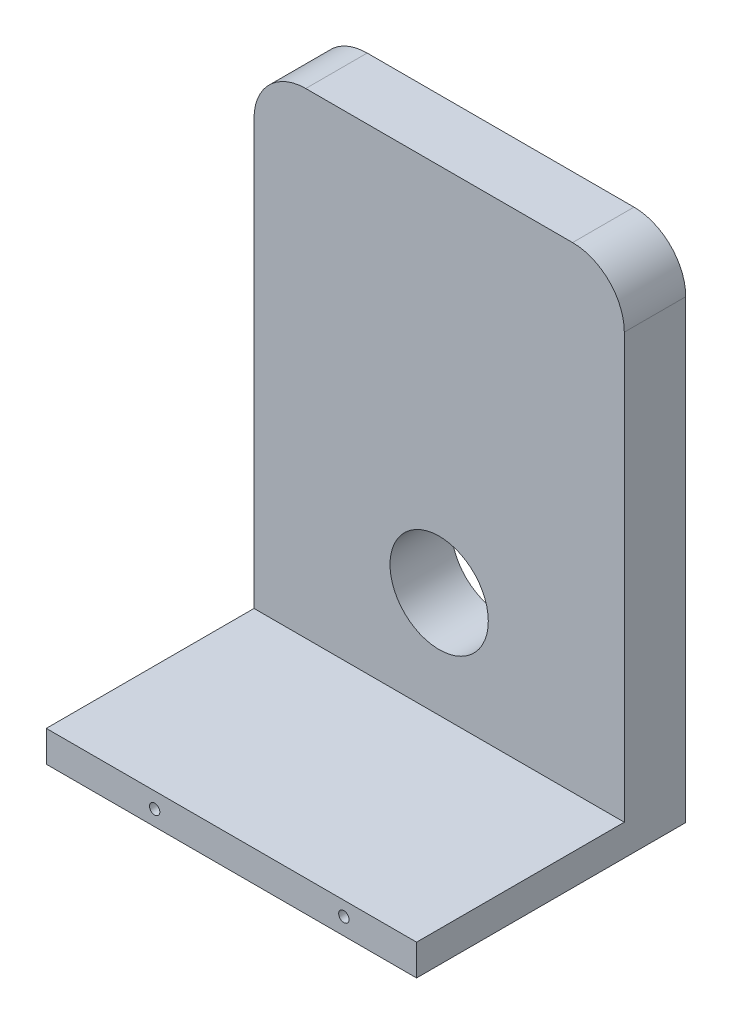
from build123d import *

# Parameters (mm, degrees)
FRONT_WALL_DEPTH               = 7.300124661
FRONT_WALL_DEPTH_BACK          = 4.572
SKETCH1_W                      = 71.574446128
SKETCH1_H                      = 98.031926214
SKETCH2_W                      = 71.574446128
SKETCH2_H                      = 6
BOSS_EXTRUDE1_DEPTH            = 47.452211665
HOLE_FOR_CENTER_ROD_DEPTH      = 34
HOLE_FOR_CENTER_ROD_DEPTH_BACK = 24
SKETCH3_R                      = 9.5
FILLET2_R                      = 10
FILLET3_R                      = 10
BASE_HOLES_DEPTH               = 22
BASE_HOLES_DEPTH_BACK          = 24
SKETCH4_R                      = 1


with BuildPart() as part:
    # Sketch1 → Front wall (new, two sides: drawn at the far end of the back side and taken through both)
    with BuildSketch(Plane.XY.offset(-FRONT_WALL_DEPTH_BACK)):
        Rectangle(SKETCH1_W, SKETCH1_H)
    extrude(amount=FRONT_WALL_DEPTH + FRONT_WALL_DEPTH_BACK)

    # Sketch2 → Boss-Extrude1 (add)
    with BuildSketch(Plane.XY):
        with Locations((0, -46.015963107)):
            Rectangle(SKETCH2_W, SKETCH2_H)
    extrude(amount=BOSS_EXTRUDE1_DEPTH)

    # Sketch3 → Hole for center rod (cut, two sides: drawn at the far end of the back side and taken through both)
    with BuildSketch(Plane.XY.offset(-HOLE_FOR_CENTER_ROD_DEPTH_BACK)):
        with Locations((0, -22.515963107)):
            Circle(SKETCH3_R)
    extrude(amount=HOLE_FOR_CENTER_ROD_DEPTH + HOLE_FOR_CENTER_ROD_DEPTH_BACK, mode=Mode.SUBTRACT)

    # Fillet2
    fillet2_edges = [part.edges().sort_by_distance(p)[0] for p in [
        (-35.787223064, 49.015963107, 1.36406233),
    ]]
    fillet(fillet2_edges, radius=FILLET2_R)

    # Fillet3
    fillet3_edges = [part.edges().sort_by_distance(p)[0] for p in [
        (35.787223064, 49.015963107, 1.36406233),
    ]]
    fillet(fillet3_edges, radius=FILLET3_R)

    # Sketch4 → base holes (cut, two sides: drawn at the far end of the back side and taken through both)
    with BuildSketch(Plane.XY.offset(47.452211665).offset(-BASE_HOLES_DEPTH_BACK)):
        with Locations((-14.841013248, -46.05275869)):
            Circle(SKETCH4_R)
        with Locations((21.729314916, -45.766012442)):
            Circle(SKETCH4_R)
    extrude(amount=BASE_HOLES_DEPTH + BASE_HOLES_DEPTH_BACK, mode=Mode.SUBTRACT)


solid = part.part
